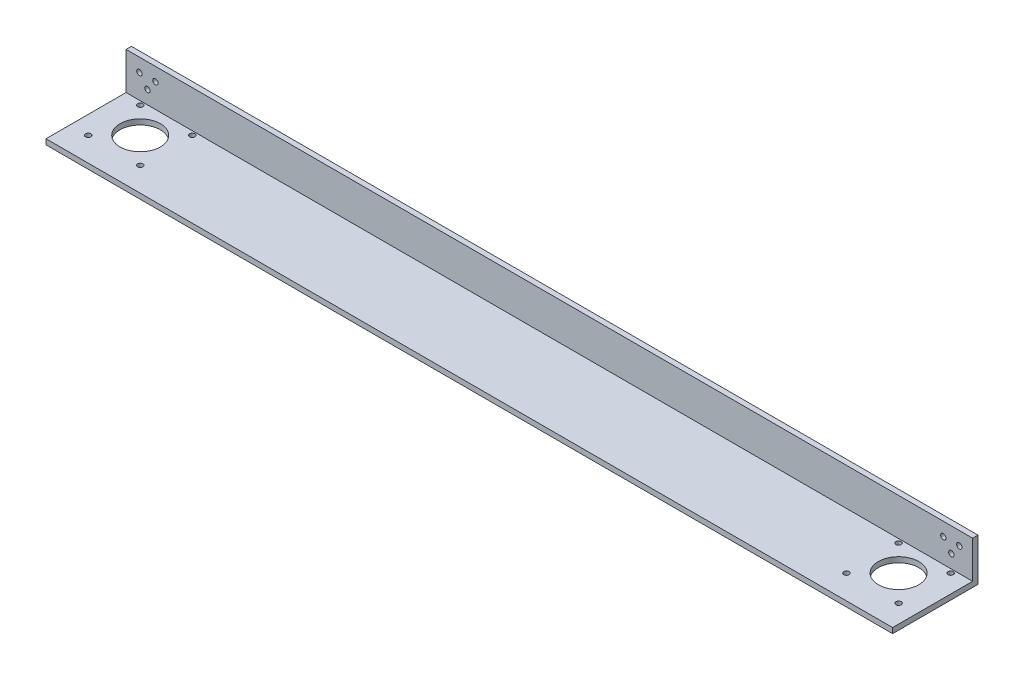
from build123d import *

# Parameters (mm, degrees)
BOSS_EXTRUDE1_DEPTH              = 503.65
TOPHOLES_SKETCH2_R               = 12
TOPHOLES_SKETCH2_R_2             = 1.5875
TOPHOLES_CUT_EXTRUDE1_DEPTH      = 507.693115332
BACKSIDEHOLES_SKETCH3_R          = 1.5875
BACKSIDEHOLES_CUT_EXTRUDE2_DEPTH = 507.842305357


with BuildPart() as part:
    # Sketch1 → Boss-Extrude1 (new body)
    with BuildSketch(Plane(origin=(0, 0, 0), x_dir=(0, 0, -1), z_dir=(1, 0, 0))):
        Polygon((0, 0), (-50.8, 0), (-50.8, 3.175), (-3.175, 3.175), (-3.175, 25.4), (0, 25.4), align=None)
    extrude(amount=BOSS_EXTRUDE1_DEPTH)

    # TopHoles-Sketch2 → TopHoles-Cut-Extrude1 (cut, through all)
    with BuildSketch(Plane(origin=(0, 3.175, 0), x_dir=(1, 0, 0), z_dir=(0, 1, 0))):
        with Locations((26.25, -21)):
            Circle(TOPHOLES_SKETCH2_R)
        with Locations((477.4, -21)):
            Circle(TOPHOLES_SKETCH2_R)
        with Locations((10.75, -5.5)):
            Circle(TOPHOLES_SKETCH2_R_2)
        with Locations((41.75, -5.5)):
            Circle(TOPHOLES_SKETCH2_R_2)
        with Locations((461.9, -5.5)):
            Circle(TOPHOLES_SKETCH2_R_2)
        with Locations((492.9, -5.5)):
            Circle(TOPHOLES_SKETCH2_R_2)
        with Locations((10.75, -36.5)):
            Circle(TOPHOLES_SKETCH2_R_2)
        with Locations((41.75, -36.5)):
            Circle(TOPHOLES_SKETCH2_R_2)
        with Locations((461.9, -36.5)):
            Circle(TOPHOLES_SKETCH2_R_2)
        with Locations((492.9, -36.5)):
            Circle(TOPHOLES_SKETCH2_R_2)
    extrude(amount=-TOPHOLES_CUT_EXTRUDE1_DEPTH, mode=Mode.SUBTRACT)

    # BackSideHoles-Sketch3 → BackSideHoles-Cut-Extrude2 (cut, through all)
    with BuildSketch(Plane(origin=(0, 0, 0), x_dir=(-1, 0, 0), z_dir=(0, 0, -1))):
        with Locations((-495.7125, 17.4625)):
            Circle(BACKSIDEHOLES_SKETCH3_R)
        with Locations((-486.1875, 17.4625)):
            Circle(BACKSIDEHOLES_SKETCH3_R)
        with Locations((-490.95, 11.1125)):
            Circle(BACKSIDEHOLES_SKETCH3_R)
        with Locations((-12.7, 11.1125)):
            Circle(BACKSIDEHOLES_SKETCH3_R)
        with Locations((-17.4625, 17.4625)):
            Circle(BACKSIDEHOLES_SKETCH3_R)
        with Locations((-7.9375, 17.4625)):
            Circle(BACKSIDEHOLES_SKETCH3_R)
    extrude(amount=-BACKSIDEHOLES_CUT_EXTRUDE2_DEPTH, mode=Mode.SUBTRACT)


solid = part.part
